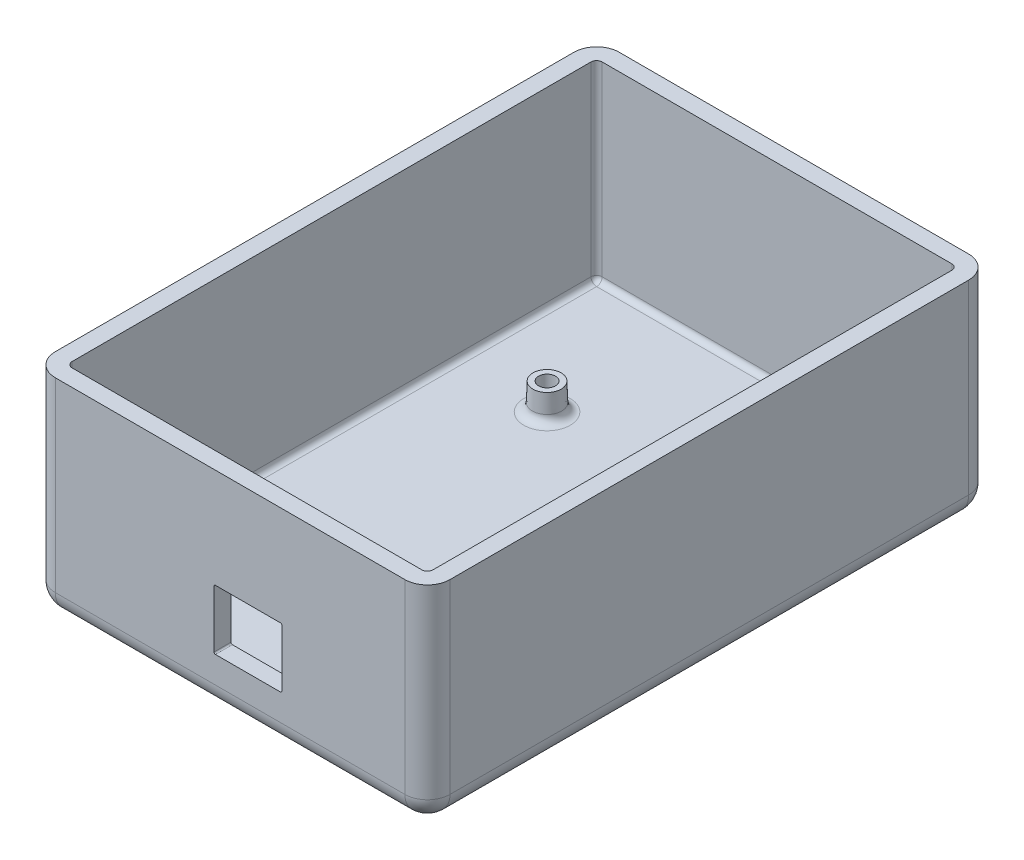
from build123d import *

# Parameters (mm, degrees)
SKETCH_100X70_W                     = 70
SKETCH_100X70_H                     = 100
BOSS_EXTRUDE_MAINBOX_37MM_DEPTH     = 37
FILLET_MAINOUTSIDEFILLET_4MM_R      = 4
SHELL_MAINSHELL_3MM_T               = -3
CUT_EXTRUDE_USB_B_PORT_IN_PCB_DEPTH = 37
CUT_EXTRUDE_WIRESOUT_DEPTH          = 10
FILLET_FORMOUNTINGBOSSINPCB_R       = 1.5


# Read off the part's stored shape, not the designer's step: Mounting Boss-PCBMount1, Mounting Boss-PCBMount3
with BuildPart() as part:
    # Sketch-100x70 → Boss-Extrude-MainBox 37mm (new body)
    with BuildSketch(Plane(origin=(0, 0, 0), x_dir=(1, 0, 0), z_dir=(0, 1, 0))):
        Rectangle(SKETCH_100X70_W, SKETCH_100X70_H)
    extrude(amount=BOSS_EXTRUDE_MAINBOX_37MM_DEPTH)

    # Fillet-MainOutSideFillet 4mm
    fillet_mainoutsidefillet_4mm_edges = [part.edges().sort_by_distance(p)[0] for p in [
        (0, 0, 50),
        (-35, 0, 0),
        (0, 0, -50),
        (35, 0, 0),
        (35, 18.5, 50),
        (-35, 18.5, 50),
        (-35, 18.5, -50),
        (35, 18.5, -50),
    ]]
    fillet(fillet_mainoutsidefillet_4mm_edges, radius=FILLET_MAINOUTSIDEFILLET_4MM_R)

    # Shell-MainShell 3mm
    shell_mainshell_3mm_openings = [part.faces().sort_by_distance(p)[0] for p in [
        (0, 37, 0),
    ]]
    offset(amount=SHELL_MAINSHELL_3MM_T, openings=shell_mainshell_3mm_openings, kind=Kind.INTERSECTION)

    # Mounting Boss-PCBMount1 outline → Mounting Boss-PCBMount1 (revolve, cut)
    with BuildSketch(Plane(origin=(16.146166208, 0, -22.359059727), x_dir=(1, 0, 0), z_dir=(0, 0, 1))):
        Polygon((1.412724675, 2.746), (1.417158262, 3), (0, 3), (0, 2.746), align=None)
    mounting_boss_pcbmount1 = revolve(axis=Axis((16.146166208, 0, -22.359059727), (0, 1, 0)), mode=Mode.SUBTRACT)

    # Mounting Boss-PCBMount1 2 outline → Mounting Boss-PCBMount1 2 (revolve)
    with BuildSketch(Plane(origin=(16.146166208, 0, -22.359059727), x_dir=(1, 0, 0), z_dir=(0, 0, 1))):
        Polygon((2.5, 7.746), (1.5, 7.746), (1.417158262, 3), (2.665733972, 3), align=None)
    mounting_boss_pcbmount1_2 = revolve(axis=Axis((16.146166208, 0, -22.359059727), (0, 1, 0)))

    # Mounting Boss-PCBMount3 outline → Mounting Boss-PCBMount3 (revolve, cut)
    with BuildSketch(Plane(origin=(16.146166208, 0, 41.376671572), x_dir=(1, 0, 0), z_dir=(0, 0, 1))):
        Polygon((1.412724675, 2.746), (1.417158262, 3), (0, 3), (0, 2.746), align=None)
    mounting_boss_pcbmount3 = revolve(axis=Axis((16.146166208, 0, 41.376671572), (0, 1, 0)), mode=Mode.SUBTRACT)

    # Mounting Boss-PCBMount3 2 outline → Mounting Boss-PCBMount3 2 (revolve)
    with BuildSketch(Plane(origin=(16.146166208, 0, 41.376671572), x_dir=(1, 0, 0), z_dir=(0, 0, 1))):
        Polygon((2.5, 7.746), (1.5, 7.746), (1.417158262, 3), (2.665733972, 3), align=None)
    mounting_boss_pcbmount3_2 = revolve(axis=Axis((16.146166208, 0, 41.376671572), (0, 1, 0)))

    # Mirror-PCBMount2and4: Mounting Boss-PCBMount1, Mounting Boss-PCBMount1 2, Mounting Boss-PCBMount3, Mounting Boss-PCBMount3 2 across plane
    add(mounting_boss_pcbmount1.mirror(Plane(origin=(0, 0, 0), x_dir=(0, 0, 1), z_dir=(1, 0, 0))), mode=Mode.SUBTRACT)
    add(mounting_boss_pcbmount1_2.mirror(Plane(origin=(0, 0, 0), x_dir=(0, 0, 1), z_dir=(1, 0, 0))))
    add(mounting_boss_pcbmount3.mirror(Plane(origin=(0, 0, 0), x_dir=(0, 0, 1), z_dir=(1, 0, 0))), mode=Mode.SUBTRACT)
    add(mounting_boss_pcbmount3_2.mirror(Plane(origin=(0, 0, 0), x_dir=(0, 0, 1), z_dir=(1, 0, 0))))

    # Sketch-USB-B-Port → Cut-Extrude-USB-B-Port-In-PCB (cut)
    with BuildSketch(Plane.XY.offset(50)):
        with BuildLine():
            Line((-2.59188207, 19.317464921), (8.927441523, 19.317464921))
            ThreePointArc((8.927441523, 19.317464921), (9.111289286, 19.241312685), (9.187441523, 19.057464921))
            Line((9.187441523, 19.057464921), (9.187441523, 8.957464936))
            ThreePointArc((9.187441523, 8.957464936), (9.111289286, 8.773617173), (8.927441523, 8.697464936))
            Line((8.927441523, 8.697464936), (-2.592438211, 8.697464936))
            ThreePointArc((-2.592438211, 8.697464936), (-2.770993678, 8.775816965), (-2.841848208, 8.957477997))
            Line((-2.841848208, 8.957477997), (-2.841848208, 19.052478011))
            ThreePointArc((-2.841848208, 19.052478011), (-2.771745725, 19.236741148), (-2.59188207, 19.317464921))
        make_face()
    extrude(amount=-CUT_EXTRUDE_USB_B_PORT_IN_PCB_DEPTH, mode=Mode.SUBTRACT)

    # Sketch-WiresOutForModule → Cut-Extrude-WiresOut (cut)
    with BuildSketch(Plane(origin=(0, 0, -50), x_dir=(-1, 0, 0), z_dir=(0, 0, -1))):
        with BuildLine():
            ThreePointArc((-14, 17), (-14.585786438, 18.414213562), (-16, 19))
            Line((-16, 19), (-16, 17))
            Line((-16, 17), (-18, 17))
            ThreePointArc((-18, 17), (-16, 15), (-14, 17))
        make_face()
        with BuildLine():
            Line((-16, 17), (-16, 19))
            ThreePointArc((-16, 19), (-17.414213562, 18.414213562), (-18, 17))
            Line((-18, 17), (-16, 17))
        make_face()
    extrude(amount=-CUT_EXTRUDE_WIRESOUT_DEPTH, mode=Mode.SUBTRACT)

    # Fillet-ForMountingBossInPCB
    fillet_formountingbossinpcb_edges = [part.edges().sort_by_distance(p)[0] for p in [
        (13.480432236, 3, -22.359059727),
        (13.480432236, 3, 41.376671572),
        (-13.480432236, 3, 41.376671572),
        (-13.480432236, 3, -22.359059727),
    ]]
    fillet(fillet_formountingbossinpcb_edges, radius=FILLET_FORMOUNTINGBOSSINPCB_R)


solid = part.part
